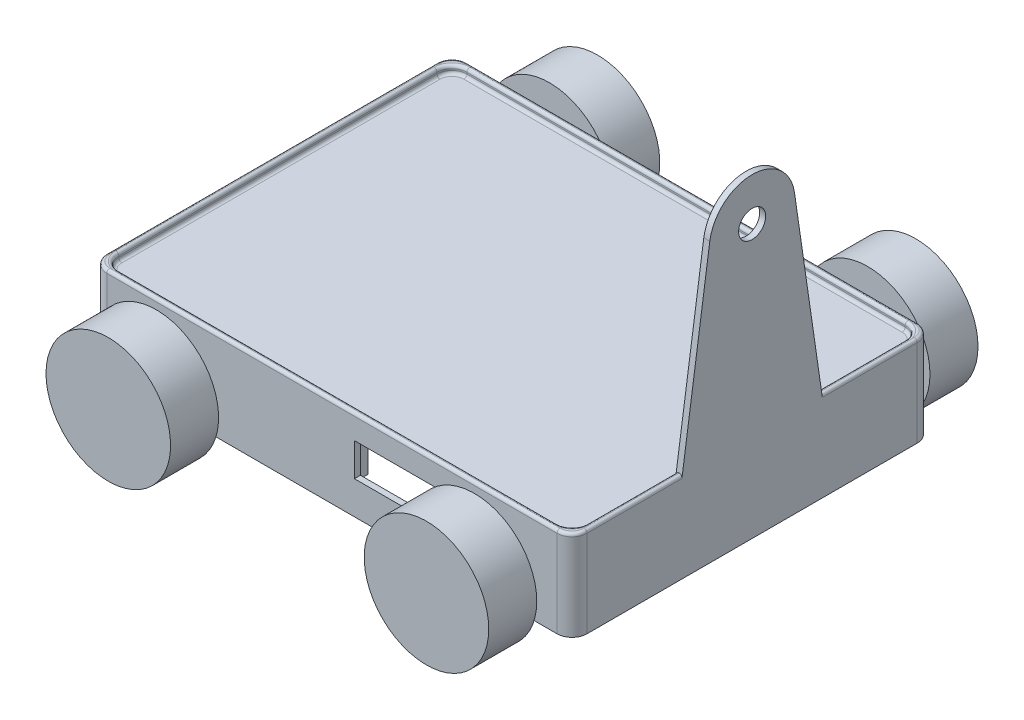
from build123d import *

# Parameters (mm, degrees)
SKETCH1_W               = 320
SKETCH1_H               = 240
BOSS_EXTRUDE1_DEPTH     = 5
SKETCH3_W               = 320
SKETCH3_H               = 240
SKETCH3_W_2             = 312
SKETCH3_H_2             = 232
BOSS_EXTRUDE3_DEPTH     = 5
SKETCH6_W               = 320
SKETCH6_H               = 240
SKETCH6_W_2             = 312
SKETCH6_H_2             = 232
BOSS_EXTRUDE6_DEPTH     = 50
FILLET2_R               = 10
SKETCH7_W               = 40
SKETCH7_H               = 40
BOSS_EXTRUDE7_DEPTH     = 2
SKETCH8_W               = 40
SKETCH8_H               = 2
BOSS_EXTRUDE8_DEPTH     = 45
FILLET3_R               = 20
SKETCH9_R               = 10
CUT_EXTRUDE1_DEPTH      = 286.413734778
SKETCH16_R              = 1.5
CUT_EXTRUDE2_DEPTH      = 2
SKETCH18_R              = 1.95
CUT_EXTRUDE3_DEPTH      = 3.5
SKETCH11_R              = 15
BOSS_EXTRUDE9_DEPTH     = 45
SKETCH12_R              = 2.607463095
BOSS_EXTRUDE10_DEPTH    = 20
SKETCH15_R              = 41.5
BOSS_EXTRUDE11_DEPTH    = 32
BOSS_EXTRUDE12_DEPTH    = 4.5
SKETCH23_W              = 40
SKETCH23_H              = 3
CUT_EXTRUDE6_DEPTH      = 4.5
MIRROR5_COPY_1_SKETCH_R = 10
MIRROR5_COPY_1_DEPTH    = 286.413734778
MIRROR5_COPY_2_SKETCH_R = 1.95
MIRROR5_COPY_2_DEPTH    = 3.5
MIRROR5_COPY_3_SKETCH_W = 40
MIRROR5_COPY_3_SKETCH_H = 3
MIRROR5_COPY_3_DEPTH    = 4.5
SKETCH19_R              = 1.95
CUT_EXTRUDE4_DEPTH      = 3.5
LPATTERN1_COUNT         = 2
LPATTERN1_PITCH         = 80
LPATTERN1_COL_COUNT     = 2
LPATTERN1_COL_PITCH     = 80
MIRROR6_COPY_1_SKETCH_R = 1.95
MIRROR6_COPY_1_DEPTH    = 3.5
MIRROR6_COPY_2_SKETCH_R = 1.95
MIRROR6_COPY_2_DEPTH    = 3.5
SKETCH20_R              = 1.95
CUT_EXTRUDE5_DEPTH      = 3.5
LPATTERN2_COUNT         = 2
LPATTERN2_PITCH         = 60
LPATTERN2_COL_COUNT     = 2
LPATTERN2_COL_PITCH     = 60
MIRROR7_COPY_1_SKETCH_R = 1.95
MIRROR7_COPY_1_DEPTH    = 3.5
MIRROR7_COPY_2_SKETCH_R = 1.95
MIRROR7_COPY_2_DEPTH    = 3.5
SKETCH24_W              = 10
SKETCH24_H              = 220
BOSS_EXTRUDE13_DEPTH    = 15
SKETCH25_W              = 10
SKETCH25_H              = 30
CUT_EXTRUDE7_DEPTH      = 15
CUT_EXTRUDE8_DEPTH      = 2
SKETCH28_R              = 2.95
CUT_EXTRUDE9_DEPTH      = 2
SKETCH29_R              = 1.3
CUT_EXTRUDE10_DEPTH     = 6
SKETCH30_W              = 10
SKETCH30_H              = 40
BOSS_EXTRUDE14_DEPTH    = 15
CUT_EXTRUDE11_DEPTH     = 2
SKETCH32_R              = 2.95
CUT_EXTRUDE12_DEPTH     = 2
SKETCH33_R              = 1.3
CUT_EXTRUDE13_DEPTH     = 6
SKETCH34_R              = 1.95
CUT_EXTRUDE14_DEPTH     = 3.5
SKETCH35_W              = 56
SKETCH35_H              = 85
BOSS_EXTRUDE15_DEPTH    = 3.5
SKETCH38_W              = 56
SKETCH38_H              = 22
CUT_EXTRUDE15_DEPTH     = 329.836205428
SKETCH39_R              = 1.95
CUT_EXTRUDE16_DEPTH     = 3.5
SKETCH40_W              = 3
SKETCH40_H              = 25
CUT_EXTRUDE17_DEPTH     = 239.455970779
SKETCH42_W              = 138
SKETCH42_H              = 95
BOSS_EXTRUDE16_DEPTH    = 25
SKETCH41_R              = 1.95
CUT_EXTRUDE18_DEPTH     = 3.5
SKETCH43_R              = 1.95
CUT_EXTRUDE19_DEPTH     = 3.5
SKETCH44_R              = 1.95
CUT_EXTRUDE20_DEPTH     = 3.5
SKETCH45_R              = 1.95
CUT_EXTRUDE21_DEPTH     = 3.5
SKETCH46_R              = 1.95
CUT_EXTRUDE22_DEPTH     = 3.5
SKETCH47_R              = 1.95
CUT_EXTRUDE23_DEPTH     = 3.5
SKETCH48_R              = 1.95
CUT_EXTRUDE24_DEPTH     = 3.5
SKETCH49_R              = 28.5
BOSS_EXTRUDE17_DEPTH    = 4
SKETCH50_R              = 9
CUT_EXTRUDE25_DEPTH     = 394.152642112
FILLET4_R               = 2
FILLET5_R               = 2


with BuildPart() as part:
    # Sketch1 → Boss-Extrude1 (new body)
    with BuildSketch(Plane(origin=(0, 0, 0), x_dir=(1, 0, 0), z_dir=(0, 1, 0))):
        Rectangle(SKETCH1_W, SKETCH1_H)
    extrude(amount=BOSS_EXTRUDE1_DEPTH)

    # Sketch3 → Boss-Extrude3 (add)
    with BuildSketch(Plane(origin=(0, 5, 0), x_dir=(1, 0, 0), z_dir=(0, 1, 0))):
        Rectangle(SKETCH3_W, SKETCH3_H)
        Rectangle(SKETCH3_W_2, SKETCH3_H_2, mode=Mode.SUBTRACT)
    extrude(amount=BOSS_EXTRUDE3_DEPTH)

    # Sketch6 → Boss-Extrude6 (add)
    with BuildSketch(Plane.XZ):
        Rectangle(SKETCH6_W, SKETCH6_H)
        Rectangle(SKETCH6_W_2, SKETCH6_H_2, mode=Mode.SUBTRACT)
    extrude(amount=BOSS_EXTRUDE6_DEPTH)

    # Fillet2
    fillet2_edges = [part.edges().sort_by_distance(p)[0] for p in [
        (156, 7.5, -116),
        (-156, 7.5, -116),
        (-156, 7.5, 116),
        (156, 7.5, 116),
        (-156, -25, 116),
        (-156, -25, -116),
        (156, -25, -116),
        (156, -25, 116),
        (160, -20, 120),
        (-160, -20, 120),
        (-160, -20, -120),
        (160, -20, -120),
    ]]
    fillet(fillet2_edges, radius=FILLET2_R)


with BuildPart() as body_2:
    # Sketch7 → Boss-Extrude7 (new body)
    with BuildSketch(Plane.XZ):
        with Locations((-106, -93)):
            Rectangle(SKETCH7_W, SKETCH7_H)
    extrude(amount=BOSS_EXTRUDE7_DEPTH)

    # Sketch8 → Boss-Extrude8 (add)
    with BuildSketch(Plane.XZ.offset(2)):
        with Locations((-106, -112)):
            Rectangle(SKETCH8_W, SKETCH8_H)
    extrude(amount=BOSS_EXTRUDE8_DEPTH)

    # Fillet3
    fillet3_edges = [body_2.edges().sort_by_distance(p)[0] for p in [
        (-126, -47, -112),
        (-86, -47, -112),
    ]]
    fillet(fillet3_edges, radius=FILLET3_R - 0.0001)  # a hair under: the kernel refuses the full size


with BuildPart() as cut_extrude1_tool:
    # Sketch9 → Cut-Extrude1 (new, through all)
    with BuildSketch(Plane.XY.offset(-111)):
        with Locations((-106, -27)):
            Circle(SKETCH9_R)
    cut_extrude1 = extrude(amount=-CUT_EXTRUDE1_DEPTH)


with BuildPart() as part_1:
    add(part.part)

    # Cut-Extrude1: cut by cut_extrude1_tool
    add(cut_extrude1_tool.part, mode=Mode.SUBTRACT)

    # Sketch18 → Cut-Extrude3 (cut)
    with BuildSketch(Plane.XZ):
        with Locations(Location((-91, -81, 0), (0, 0, 270))):
            Circle(SKETCH18_R)
        with Locations(Location((-91, -105, 0), (0, 0, 270))):
            Circle(SKETCH18_R)
        with Locations(Location((-121, -105, 0), (0, 0, 270))):
            Circle(SKETCH18_R)
        with Locations(Location((-121, -81, 0), (0, 0, 270))):
            Circle(SKETCH18_R)
    cut_extrude3 = extrude(amount=-CUT_EXTRUDE3_DEPTH, mode=Mode.SUBTRACT)

    # Sketch22 → Boss-Extrude12 (add)
    with BuildSketch(Plane.XZ.offset(50)):
        with BuildLine():
            Line((-146, -116), (146, -116))
            ThreePointArc((146, -116), (153.071067812, -113.071067812), (156, -106))
            Line((156, -106), (156, 106))
            ThreePointArc((156, 106), (153.071067812, 113.071067812), (146, 116))
            Line((146, 116), (-146, 116))
            ThreePointArc((-146, 116), (-153.071067812, 113.071067812), (-156, 106))
            Line((-156, 106), (-156, -106))
            ThreePointArc((-156, -106), (-153.071067812, -113.071067812), (-146, -116))
        make_face()
        with BuildLine():
            Line((152, -106), (152, 106))
            ThreePointArc((152, 106), (150.242640687, 110.242640687), (146, 112))
            Line((146, 112), (-146, 112))
            ThreePointArc((-146, 112), (-150.242640687, 110.242640687), (-152, 106))
            Line((-152, 106), (-152, -106))
            ThreePointArc((-152, -106), (-150.242640687, -110.242640687), (-146, -112))
            Line((-146, -112), (146, -112))
            ThreePointArc((146, -112), (150.242640687, -110.242640687), (152, -106))
        make_face(mode=Mode.SUBTRACT)
    extrude(amount=-BOSS_EXTRUDE12_DEPTH)

    # Sketch23 → Cut-Extrude6 (cut)
    with BuildSketch(Plane.XZ.offset(50)):
        with Locations((-106, -113.5)):
            Rectangle(SKETCH23_W, SKETCH23_H)
    cut_extrude6 = extrude(amount=-CUT_EXTRUDE6_DEPTH, mode=Mode.SUBTRACT)

    # Mirror4: Cut-Extrude1, Cut-Extrude3, Cut-Extrude6 across plane
    add(cut_extrude1.mirror(Plane(origin=(0, 0, 0), x_dir=(0, 0, 1), z_dir=(1, 0, 0))), mode=Mode.SUBTRACT)
    add(cut_extrude3.mirror(Plane(origin=(0, 0, 0), x_dir=(0, 0, 1), z_dir=(1, 0, 0))), mode=Mode.SUBTRACT)
    add(cut_extrude6.mirror(Plane(origin=(0, 0, 0), x_dir=(0, 0, 1), z_dir=(1, 0, 0))), mode=Mode.SUBTRACT)

    # Mirror5: Cut-Extrude1, Cut-Extrude3, Cut-Extrude6 across plane
    add(cut_extrude1.mirror(Plane.XY), mode=Mode.SUBTRACT)
    add(cut_extrude3.mirror(Plane.XY), mode=Mode.SUBTRACT)
    add(cut_extrude6.mirror(Plane.XY), mode=Mode.SUBTRACT)

    # Mirror5 copy 1 sketch → Mirror5 copy 1 (cut, through all)
    with BuildSketch(Plane(origin=(0, 0, 111), x_dir=(-1, 0, 0), z_dir=(0, 0, -1))):
        with Locations((-106, -27)):
            Circle(MIRROR5_COPY_1_SKETCH_R)
    extrude(amount=-MIRROR5_COPY_1_DEPTH, mode=Mode.SUBTRACT)

    # Mirror5 copy 2 sketch → Mirror5 copy 2 (cut)
    with BuildSketch(Plane(origin=(0, 0, 0), x_dir=(-1, 0, 0), z_dir=(0, -1, 0))):
        with Locations(Location((-91, -81, 0), (0, 0, 270))):
            Circle(MIRROR5_COPY_2_SKETCH_R)
        with Locations(Location((-91, -105, 0), (0, 0, 270))):
            Circle(MIRROR5_COPY_2_SKETCH_R)
        with Locations(Location((-121, -105, 0), (0, 0, 270))):
            Circle(MIRROR5_COPY_2_SKETCH_R)
        with Locations(Location((-121, -81, 0), (0, 0, 270))):
            Circle(MIRROR5_COPY_2_SKETCH_R)
    extrude(amount=-MIRROR5_COPY_2_DEPTH, mode=Mode.SUBTRACT)

    # Mirror5 copy 3 sketch → Mirror5 copy 3 (cut)
    with BuildSketch(Plane(origin=(0, -50, 0), x_dir=(-1, 0, 0), z_dir=(0, -1, 0))):
        with Locations((-106, -113.5)):
            Rectangle(MIRROR5_COPY_3_SKETCH_W, MIRROR5_COPY_3_SKETCH_H)
    extrude(amount=-MIRROR5_COPY_3_DEPTH, mode=Mode.SUBTRACT)

    # Sketch19 → Cut-Extrude4 (cut)
    with BuildSketch(Plane.XZ.offset(50)):
        with Locations(Location((-156, 0, 0), (0, 0, 270))):
            Circle(SKETCH19_R)
    cut_extrude4 = extrude(amount=-CUT_EXTRUDE4_DEPTH, mode=Mode.SUBTRACT)

    # LPattern1: Cut-Extrude4 ×2
    with Locations(*[(0, 0, -i * LPATTERN1_PITCH) for i in range(1, LPATTERN1_COUNT)]):
        add(cut_extrude4, mode=Mode.SUBTRACT)

    # LPattern1 col: Cut-Extrude4 ×2
    with Locations(*[(0, 0, i * LPATTERN1_COL_PITCH) for i in range(1, LPATTERN1_COL_COUNT)]):
        add(cut_extrude4, mode=Mode.SUBTRACT)

    # Mirror6: Cut-Extrude4 across plane
    add(cut_extrude4.mirror(Plane(origin=(0, 0, 0), x_dir=(0, 0, 1), z_dir=(1, 0, 0))), mode=Mode.SUBTRACT)

    # Mirror6 copy 1 sketch → Mirror6 copy 1 (cut)
    with BuildSketch(Plane(origin=(0, -50, -80), x_dir=(-1, 0, 0), z_dir=(0, -1, 0))):
        with Locations((-156, 0)):
            Circle(MIRROR6_COPY_1_SKETCH_R)
    extrude(amount=-MIRROR6_COPY_1_DEPTH, mode=Mode.SUBTRACT)

    # Mirror6 copy 2 sketch → Mirror6 copy 2 (cut)
    with BuildSketch(Plane(origin=(0, -50, 80), x_dir=(-1, 0, 0), z_dir=(0, -1, 0))):
        with Locations((-156, 0)):
            Circle(MIRROR6_COPY_2_SKETCH_R)
    extrude(amount=-MIRROR6_COPY_2_DEPTH, mode=Mode.SUBTRACT)

    # Sketch20 → Cut-Extrude5 (cut)
    with BuildSketch(Plane.XZ.offset(50)):
        with Locations(Location((0, -116, 0), (0, 0, 270))):
            Circle(SKETCH20_R)
    cut_extrude5 = extrude(amount=-CUT_EXTRUDE5_DEPTH, mode=Mode.SUBTRACT)

    # LPattern2: Cut-Extrude5 ×2
    with Locations(*[(i * LPATTERN2_PITCH, 0, 0) for i in range(1, LPATTERN2_COUNT)]):
        add(cut_extrude5, mode=Mode.SUBTRACT)

    # LPattern2 col: Cut-Extrude5 ×2
    with Locations(*[(-i * LPATTERN2_COL_PITCH, 0, 0) for i in range(1, LPATTERN2_COL_COUNT)]):
        add(cut_extrude5, mode=Mode.SUBTRACT)

    # Mirror7: Cut-Extrude5 across plane
    add(cut_extrude5.mirror(Plane.XY), mode=Mode.SUBTRACT)

    # Mirror7 copy 1 sketch → Mirror7 copy 1 (cut)
    with BuildSketch(Plane(origin=(60, -50, 0), x_dir=(1, 0, 0), z_dir=(0, -1, 0))):
        with Locations((0, 116)):
            Circle(MIRROR7_COPY_1_SKETCH_R)
    extrude(amount=-MIRROR7_COPY_1_DEPTH, mode=Mode.SUBTRACT)

    # Mirror7 copy 2 sketch → Mirror7 copy 2 (cut)
    with BuildSketch(Plane(origin=(-60, -50, 0), x_dir=(1, 0, 0), z_dir=(0, -1, 0))):
        with Locations((0, 116)):
            Circle(MIRROR7_COPY_2_SKETCH_R)
    extrude(amount=-MIRROR7_COPY_2_DEPTH, mode=Mode.SUBTRACT)

    # Sketch24 → Boss-Extrude13 (add)
    with BuildSketch(Plane.XZ):
        Rectangle(SKETCH24_W, SKETCH24_H)
    extrude(amount=BOSS_EXTRUDE13_DEPTH)

    # Sketch25 → Cut-Extrude7 (cut)
    with BuildSketch(Plane.XZ.offset(15)):
        with Locations((0, -95)):
            Rectangle(SKETCH25_W, SKETCH25_H)
        with Locations((0, -1.983138848)):
            Rectangle(SKETCH25_W, SKETCH25_H)
        with Locations((0, 95)):
            Rectangle(SKETCH25_W, SKETCH25_H)
    extrude(amount=-CUT_EXTRUDE7_DEPTH, mode=Mode.SUBTRACT)

    # Sketch27 → Cut-Extrude8 (cut)
    with BuildSketch(Plane(origin=(5, 0, 0), x_dir=(0, 0, -1), z_dir=(1, 0, 0))):
        Polygon((65, -10.5022214), (67.6, -9.0011107), (67.6, -5.9988893), (65, -4.4977786), (62.4, -5.9988893), (62.4, -9.0011107), align=None)
        Polygon((34.583138848, -9.0011107), (34.583138848, -5.9988893), (31.983138848, -4.4977786), (29.383138848, -5.9988893), (29.383138848, -9.0011107), (31.983138848, -10.5022214), align=None)
    cut_extrude8 = extrude(amount=-CUT_EXTRUDE8_DEPTH, mode=Mode.SUBTRACT)

    # Sketch28 → Cut-Extrude9 (cut)
    with BuildSketch(Plane.ZY.offset(5)):
        with Locations((-31.983138848, -7.5)):
            Circle(SKETCH28_R)
        with Locations((-65, -7.5)):
            Circle(SKETCH28_R)
    cut_extrude9 = extrude(amount=-CUT_EXTRUDE9_DEPTH, mode=Mode.SUBTRACT)

    # Sketch29 → Cut-Extrude10 (cut)
    with BuildSketch(Plane.ZY.offset(3)):
        with Locations((-31.983138848, -7.5)):
            Circle(SKETCH29_R)
        with Locations((-65, -7.5)):
            Circle(SKETCH29_R)
    cut_extrude10 = extrude(amount=-CUT_EXTRUDE10_DEPTH, mode=Mode.SUBTRACT)

    # Mirror8: Cut-Extrude8, Cut-Extrude9, Cut-Extrude10 across plane
    add(cut_extrude8.mirror(Plane.XY), mode=Mode.SUBTRACT)
    add(cut_extrude9.mirror(Plane.XY), mode=Mode.SUBTRACT)
    add(cut_extrude10.mirror(Plane.XY), mode=Mode.SUBTRACT)

    # Sketch30 → Boss-Extrude14 (add)
    with BuildSketch(Plane(origin=(0, 0, 116), x_dir=(-1, 0, 0), z_dir=(0, 0, -1))):
        with Locations((0, -20)):
            Rectangle(SKETCH30_W, SKETCH30_H)
    boss_extrude14 = extrude(amount=BOSS_EXTRUDE14_DEPTH)

    # Sketch31 → Cut-Extrude11 (cut)
    with BuildSketch(Plane(origin=(5, 0, 0), x_dir=(0, 0, -1), z_dir=(1, 0, 0))):
        Polygon((-108.5, -33.0022214), (-105.9, -31.5011107), (-105.9, -28.4988893), (-108.5, -26.9977786), (-111.1, -28.4988893), (-111.1, -31.5011107), align=None)
        Polygon((-105.9, -11.5011107), (-105.9, -8.4988893), (-108.5, -6.9977786), (-111.1, -8.4988893), (-111.1, -11.5011107), (-108.5, -13.0022214), align=None)
    cut_extrude11 = extrude(amount=-CUT_EXTRUDE11_DEPTH, mode=Mode.SUBTRACT)

    # Sketch32 → Cut-Extrude12 (cut)
    with BuildSketch(Plane.ZY.offset(5)):
        with Locations((108.5, -10)):
            Circle(SKETCH32_R)
        with Locations((108.5, -30)):
            Circle(SKETCH32_R)
    cut_extrude12 = extrude(amount=-CUT_EXTRUDE12_DEPTH, mode=Mode.SUBTRACT)

    # Sketch33 → Cut-Extrude13 (cut)
    with BuildSketch(Plane.ZY.offset(3)):
        with Locations((108.5, -10)):
            Circle(SKETCH33_R)
        with Locations((108.5, -30)):
            Circle(SKETCH33_R)
    cut_extrude13 = extrude(amount=-CUT_EXTRUDE13_DEPTH, mode=Mode.SUBTRACT)

    # Mirror9: Boss-Extrude14, Cut-Extrude11, Cut-Extrude12, Cut-Extrude13 across plane
    add(boss_extrude14.mirror(Plane.XY))
    add(cut_extrude11.mirror(Plane.XY), mode=Mode.SUBTRACT)
    add(cut_extrude12.mirror(Plane.XY), mode=Mode.SUBTRACT)
    add(cut_extrude13.mirror(Plane.XY), mode=Mode.SUBTRACT)

    # Sketch34 → Cut-Extrude14 (cut)
    with BuildSketch(Plane.XZ):
        with Locations(Location((67.5, 36, 0), (0, 0, 270))):
            Circle(SKETCH34_R)
        with Locations(Location((18.5, 36, 0), (0, 0, 270))):
            Circle(SKETCH34_R)
        with Locations(Location((67.5, 94, 0), (0, 0, 270))):
            Circle(SKETCH34_R)
        with Locations(Location((18.5, 94, 0), (0, 0, 270))):
            Circle(SKETCH34_R)
    extrude(amount=-CUT_EXTRUDE14_DEPTH, mode=Mode.SUBTRACT)

    # Sketch38 → Cut-Extrude15 (cut, through all)
    with BuildSketch(Plane(origin=(0, 0, 116), x_dir=(-1, 0, 0), z_dir=(0, 0, -1))):
        with Locations((-43, -17)):
            Rectangle(SKETCH38_W, SKETCH38_H)
    extrude(amount=-CUT_EXTRUDE15_DEPTH, mode=Mode.SUBTRACT)

    # Sketch39 → Cut-Extrude16 (cut)
    with BuildSketch(Plane.XZ):
        with Locations(Location((20, -62.620458345, 0), (0, 0, 270))):
            Circle(SKETCH39_R)
        with Locations(Location((58, -62.620458345, 0), (0, 0, 270))):
            Circle(SKETCH39_R)
        with Locations(Location((58, -100.620458345, 0), (0, 0, 270))):
            Circle(SKETCH39_R)
        with Locations(Location((20, -100.620458345, 0), (0, 0, 270))):
            Circle(SKETCH39_R)
    cut_extrude16 = extrude(amount=-CUT_EXTRUDE16_DEPTH, mode=Mode.SUBTRACT)

    # Mirror10: Cut-Extrude16 across plane
    add(cut_extrude16.mirror(Plane(origin=(0, 0, 0), x_dir=(0, 0, 1), z_dir=(1, 0, 0))), mode=Mode.SUBTRACT)

    # Sketch40 → Cut-Extrude17 (cut, through all)
    with BuildSketch(Plane.XZ):
        with Locations((154.5, 0)):
            Rectangle(SKETCH40_W, SKETCH40_H)
    extrude(amount=-CUT_EXTRUDE17_DEPTH, mode=Mode.SUBTRACT)

    # Sketch41 → Cut-Extrude18 (cut)
    with BuildSketch(Plane.XZ):
        with Locations(Location((82.653251035, 0.646571544, 0), (0, 0, 270))):
            Circle(SKETCH41_R)
        with Locations(Location((82.653251035, -7.227428456, 0), (0, 0, 270))):
            Circle(SKETCH41_R)
        with Locations(Location((15.851251035, -7.227428456, 0), (0, 0, 270))):
            Circle(SKETCH41_R)
        with Locations(Location((15.851251035, 0.646571544, 0), (0, 0, 270))):
            Circle(SKETCH41_R)
    extrude(amount=-CUT_EXTRUDE18_DEPTH, mode=Mode.SUBTRACT)

    # Sketch43 → Cut-Extrude19 (cut)
    with BuildSketch(Plane.XZ):
        with Locations(Location((100.5, 33.112890938, 0), (0, 0, 270))):
            Circle(SKETCH43_R)
        with Locations(Location((136, 33.112890938, 0), (0, 0, 270))):
            Circle(SKETCH43_R)
        with Locations(Location((136, -28.387109062, 0), (0, 0, 270))):
            Circle(SKETCH43_R)
        with Locations(Location((100.5, -28.387109062, 0), (0, 0, 270))):
            Circle(SKETCH43_R)
    extrude(amount=-CUT_EXTRUDE19_DEPTH, mode=Mode.SUBTRACT)

    # Sketch44 → Cut-Extrude20 (cut)
    with BuildSketch(Plane.XZ):
        with Locations(Location((-8.599664003, 96.189508018, 0), (0, 0, 270))):
            Circle(SKETCH44_R)
        with Locations(Location((-8.599664003, 88.315508018, 0), (0, 0, 270))):
            Circle(SKETCH44_R)
        with Locations(Location((-75.401664003, 88.315508018, 0), (0, 0, 270))):
            Circle(SKETCH44_R)
        with Locations(Location((-75.401664003, 96.189508018, 0), (0, 0, 270))):
            Circle(SKETCH44_R)
    extrude(amount=-CUT_EXTRUDE20_DEPTH, mode=Mode.SUBTRACT)

    # Sketch45 → Cut-Extrude21 (cut)
    with BuildSketch(Plane.XZ):
        with Locations(Location((100.5, 43.514394175, 0), (0, 0, 270))):
            Circle(SKETCH45_R)
        with Locations(Location((136, 43.514394175, 0), (0, 0, 270))):
            Circle(SKETCH45_R)
        with Locations(Location((136, -17.985605825, 0), (0, 0, 270))):
            Circle(SKETCH45_R)
        with Locations(Location((100.5, -17.985605825, 0), (0, 0, 270))):
            Circle(SKETCH45_R)
    extrude(amount=-CUT_EXTRUDE21_DEPTH, mode=Mode.SUBTRACT)

    # Sketch46 → Cut-Extrude22 (cut)
    with BuildSketch(Plane.XZ):
        with Locations(Location((100.5, 52.532142971, 0), (0, 0, 270))):
            Circle(SKETCH46_R)
        with Locations(Location((136, 52.532142971, 0), (0, 0, 270))):
            Circle(SKETCH46_R)
        with Locations(Location((136, -8.967857029, 0), (0, 0, 270))):
            Circle(SKETCH46_R)
        with Locations(Location((100.5, -8.967857029, 0), (0, 0, 270))):
            Circle(SKETCH46_R)
    extrude(amount=-CUT_EXTRUDE22_DEPTH, mode=Mode.SUBTRACT)

    # Sketch47 → Cut-Extrude23 (cut)
    with BuildSketch(Plane.XZ):
        with Locations(Location((-61.440365312, 99.588674694, 0), (0, 0, 270))):
            Circle(SKETCH47_R)
        with Locations(Location((-23.440365312, 99.588674694, 0), (0, 0, 270))):
            Circle(SKETCH47_R)
        with Locations(Location((-23.440365312, 61.588674694, 0), (0, 0, 270))):
            Circle(SKETCH47_R)
        with Locations(Location((-61.440365312, 61.588674694, 0), (0, 0, 270))):
            Circle(SKETCH47_R)
    extrude(amount=-CUT_EXTRUDE23_DEPTH, mode=Mode.SUBTRACT)

    # Sketch48 → Cut-Extrude24 (cut)
    with BuildSketch(Plane.XZ):
        with Locations(Location((-132.290675912, 57.5, 0), (0, 0, 270))):
            Circle(SKETCH48_R)
        with Locations(Location((-87.290675912, 57.5, 0), (0, 0, 270))):
            Circle(SKETCH48_R)
        with Locations(Location((-132.290675912, -57.5, 0), (0, 0, 270))):
            Circle(SKETCH48_R)
        with Locations(Location((-87.290675912, -57.5, 0), (0, 0, 270))):
            Circle(SKETCH48_R)
    extrude(amount=-CUT_EXTRUDE24_DEPTH, mode=Mode.SUBTRACT)

    # Sketch49 → Boss-Extrude17 (add)
    with BuildSketch(Plane(origin=(160, 0, 0), x_dir=(0, 0, -1), z_dir=(1, 0, 0))):
        with BuildLine():
            ThreePointArc((28.5, 131.5), (-2.059535685, 103.074512972), (-28.202337738, 135.608302097))
            Line((-28.202337738, 135.608302097), (-46.5, 10))
            Line((-46.5, 10), (46.5, 10))
            Line((46.5, 10), (28.202337738, 135.608302097))
            ThreePointArc((28.202337738, 135.608302097), (28.425487028, 133.559535685), (28.5, 131.5))
        make_face()
        with Locations((0, 131.5)):
            Circle(SKETCH49_R)
    extrude(amount=-BOSS_EXTRUDE17_DEPTH)

    # Sketch50 → Cut-Extrude25 (cut, through all)
    with BuildSketch(Plane(origin=(160, 0, 0), x_dir=(0, 0, -1), z_dir=(1, 0, 0))):
        with Locations((0, 131.5)):
            Circle(SKETCH50_R)
    extrude(amount=-CUT_EXTRUDE25_DEPTH, mode=Mode.SUBTRACT)

    # Fillet4
    fillet4_edges = [part_1.edges().sort_by_distance(p)[0] for p in [
        (0, 10, 120),
        (-160, 10, 0),
        (160, 10, 78.25),
        (160, 10, -78.25),
        (0, 10, -120),
        (-157.071067812, 10, -117.071067812),
        (157.071067812, 10, -117.071067812),
        (157.071067812, 10, 117.071067812),
        (-157.071067812, 10, 117.071067812),
    ]]
    fillet(fillet4_edges, radius=FILLET4_R)

    # Fillet5
    fillet5_edges = [part_1.edges().sort_by_distance(p)[0] for p in [
        (156, 5, -59.25),
        (153.071067812, 5, -113.071067812),
        (0, 5, -116),
        (156, 5, 59.25),
        (153.071067812, 5, 113.071067812),
        (0, 5, 116),
        (-153.071067812, 5, 113.071067812),
        (-156, 5, 0),
        (156, 10, 76.25),
        (153.071067812, 10, 113.071067812),
        (0, 10, 116),
        (-153.071067812, 10, 113.071067812),
        (-156, 10, 0),
        (156, 10, -76.25),
        (153.071067812, 10, -113.071067812),
        (0, 10, -116),
        (-153.071067812, 5, -113.071067812),
        (-153.071067812, 10, -113.071067812),
    ]]
    fillet(fillet5_edges, radius=FILLET5_R - 0.0001)  # a hair under: the kernel refuses the full size


with BuildPart() as body_2_1:
    add(body_2.part)

    # Cut-Extrude1: cut by cut_extrude1_tool
    add(cut_extrude1_tool.part, mode=Mode.SUBTRACT)

    # Sketch16 → Cut-Extrude2 (cut)
    with BuildSketch(Plane.XZ.offset(2)):
        with Locations(Location((-91, -81, 0), (0, 0, 270))):
            Circle(SKETCH16_R)
        with Locations(Location((-91, -105, 0), (0, 0, 270))):
            Circle(SKETCH16_R)
        with Locations(Location((-121, -81, 0), (0, 0, 270))):
            Circle(SKETCH16_R)
        with Locations(Location((-121, -105, 0), (0, 0, 270))):
            Circle(SKETCH16_R)
    extrude(amount=-CUT_EXTRUDE2_DEPTH, mode=Mode.SUBTRACT)

    # Sketch11 → Boss-Extrude9 (add)
    with BuildSketch(Plane.XY.offset(-111)):
        with Locations(Location((-106, -27, 0), (0, 0, 180))):
            Circle(SKETCH11_R)
    extrude(amount=BOSS_EXTRUDE9_DEPTH)

    # Sketch12 → Boss-Extrude10 (add)
    with BuildSketch(Plane(origin=(0, 0, -111), x_dir=(-1, 0, 0), z_dir=(0, 0, -1))):
        with Locations(Location((106, -27, 0), (0, 0, 180))):
            Circle(SKETCH12_R)
    extrude(amount=BOSS_EXTRUDE10_DEPTH)

    # Sketch15 → Boss-Extrude11 (add)
    with BuildSketch(Plane(origin=(0, 0, -131), x_dir=(-1, 0, 0), z_dir=(0, 0, -1))):
        with Locations((106, -27)):
            Circle(SKETCH15_R)
    extrude(amount=BOSS_EXTRUDE11_DEPTH)


with BuildPart() as body_3:
    # Sketch35 → Boss-Extrude15 (new body)
    with BuildSketch(Plane.XZ):
        with Locations((42.043684917, 72.261739406)):
            Rectangle(SKETCH35_W, SKETCH35_H)
    extrude(amount=BOSS_EXTRUDE15_DEPTH)


with BuildPart() as body_4:
    # Sketch42 → Boss-Extrude16 (new body)
    with BuildSketch(Plane(origin=(0, 0, 0), x_dir=(-1, 0, 0), z_dir=(0, -1, 0))):
        with Locations((77.520573674, -1.730088301)):
            Rectangle(SKETCH42_W, SKETCH42_H)
    extrude(amount=BOSS_EXTRUDE16_DEPTH)


with BuildPart() as body_5:
    # Mirror11: mirrored copy
    add(body_2_1.part.mirror(Plane(origin=(0, 0, 0), x_dir=(0, 0, 1), z_dir=(1, 0, 0))))


with BuildPart() as body_6:
    # Mirror12: mirrored copy
    add(body_5.part.mirror(Plane.XY))


with BuildPart() as body_7:
    # Mirror12 2: mirrored copy
    add(body_2_1.part.mirror(Plane.XY))


solid = Compound([part_1.part, body_2_1.part, body_3.part, body_4.part, body_5.part, body_6.part, body_7.part])
